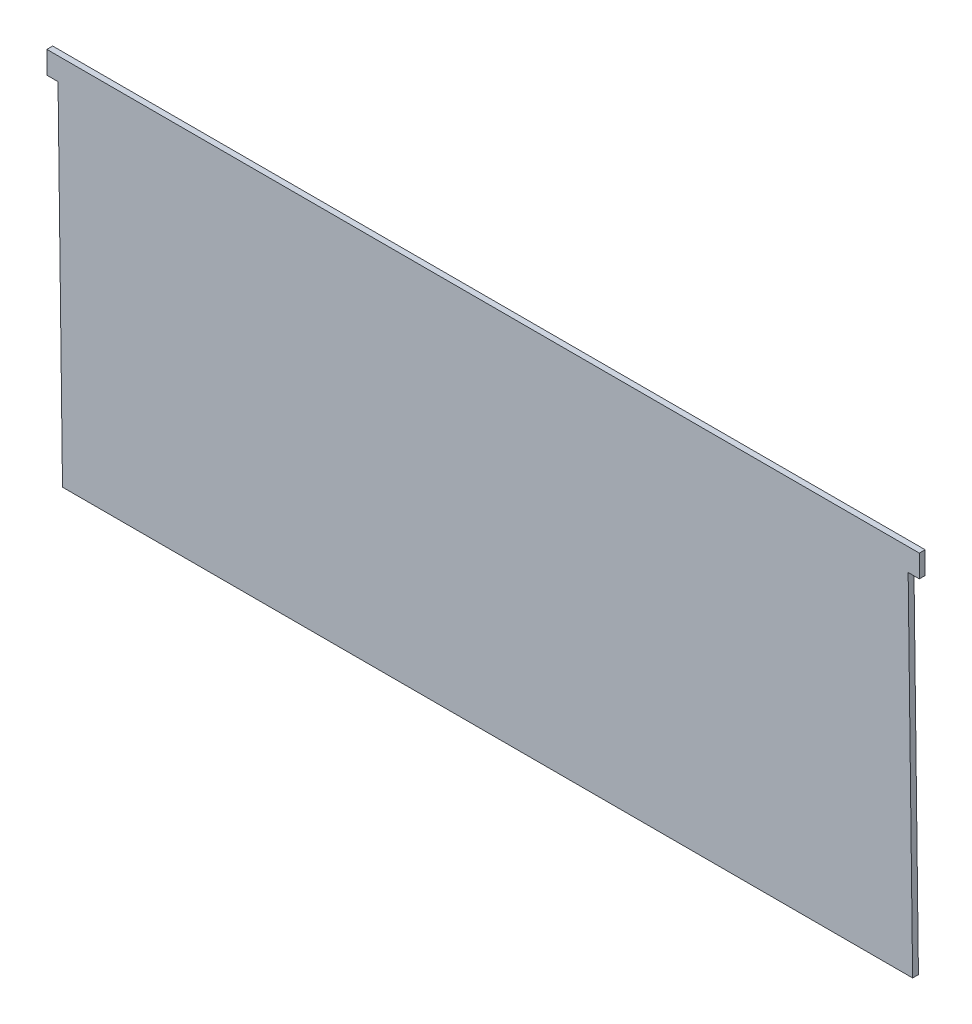
from build123d import *

# Parameters (mm, degrees)
BOSS_EXTRUDE1_DEPTH = 1.3


with BuildPart() as part:
    # Sketch1 → Boss-Extrude1 (new body)
    with BuildSketch(Plane.XY):
        Polygon((-3.499999892, 110.115018053), (-0.999999892, 110.115018053), (0, 32.121428571), (190, 32.121428571), (189, 110.121428571), (191.500000108, 110.115018053), (191.500000108, 115.115018053), (-3.499999892, 115.115018053), align=None)
    extrude(amount=BOSS_EXTRUDE1_DEPTH)


solid = part.part
